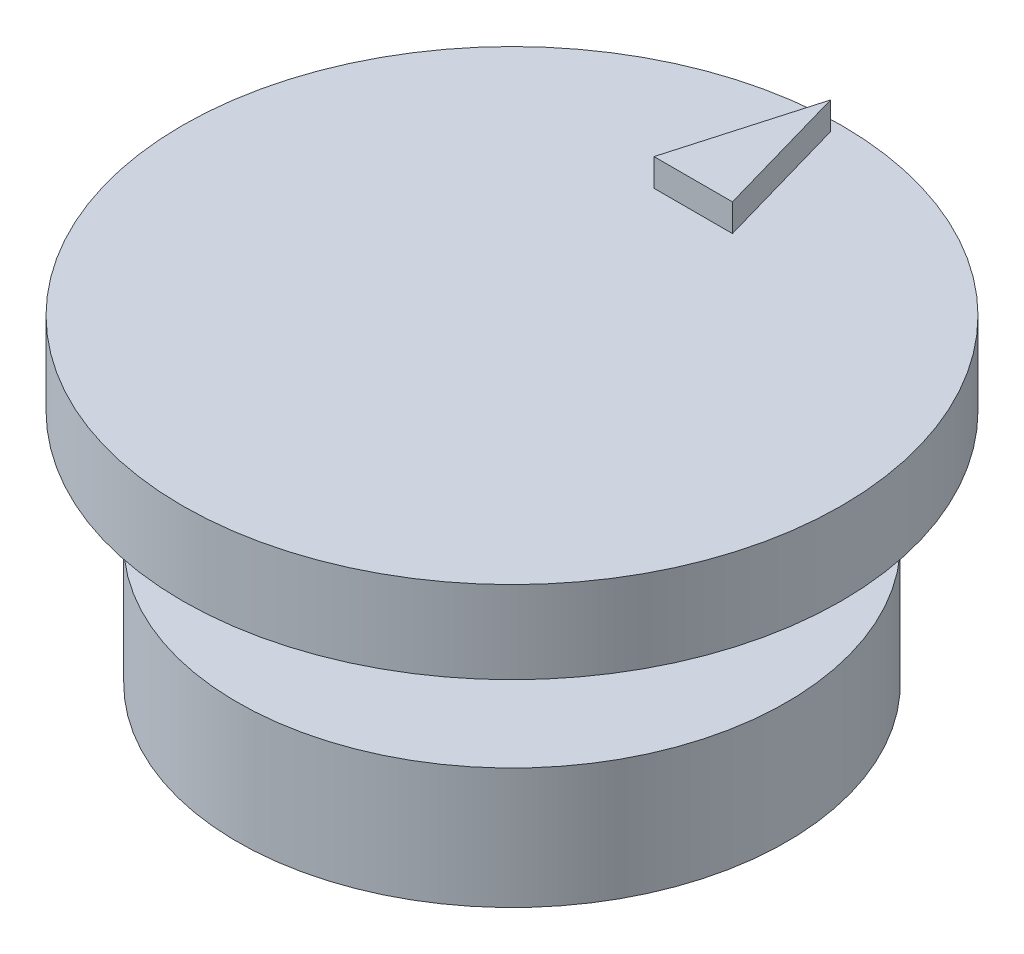
from build123d import *

# Parameters (mm, degrees)
ARROW_DEPTH = 1.27
SKETCH3_R   = 1.798915991
FLAG_DEPTH  = 6.35


with BuildPart() as part:
    # Sketch1 → dial base shape (revolve)
    with BuildSketch(Plane.XY):
        Polygon((0, -22.161058424), (0, -36.893058424), (12.7, -36.893058424), (12.7, -31.305058424), (3.175, -31.305058424), (3.175, -27.495058424), (12.7, -27.495058424), (12.7, -25.971058424), (15.24, -25.971058424), (15.24, -22.161058424), align=None)
    revolve(axis=Axis((0, -22.161058424, 0), (0, -1, 0)))

    # Sketch2 → arrow (add)
    with BuildSketch(Plane(origin=(0, -22.161058424, 0), x_dir=(1, 0, 0), z_dir=(0, 1, 0))):
        Polygon((0, 14.732), (-1.813922821, 8.382), (1.813922821, 8.382), align=None)
    extrude(amount=ARROW_DEPTH)

    # Sketch3 → flag (add)
    with BuildSketch(Plane.XZ.offset(36.893058424)):
        with Locations((0, -9.854910999)):
            Circle(SKETCH3_R)
    extrude(amount=FLAG_DEPTH)


solid = part.part
